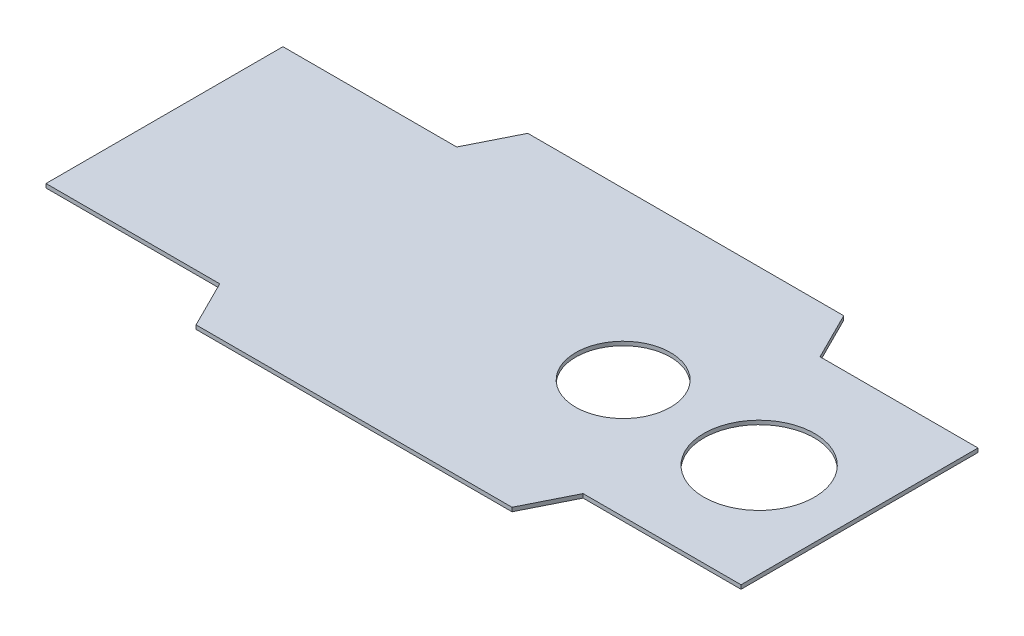
from build123d import *

# Parameters (mm, degrees)
BOSS_EXTRUDE1_DEPTH = 1.5875
SKETCH7_R           = 38.1
SKETCH7_R_2         = 44.45
CUT_EXTRUDE1_DEPTH  = 20.32


with BuildPart() as part:
    # Sketch3 → Boss-Extrude1 (new, symmetric)
    with BuildSketch(Plane(origin=(0, 0, 0), x_dir=(1, 0, 0), z_dir=(0, 1, 0))):
        Polygon((-279.4, 95.25), (-139.7, 95.25), (-120.65, 133.35), (133.35, 133.35), (152.4, 95.25), (279.4, 95.25), (279.4, -95.25), (152.4, -95.25), (133.35, -133.35), (-120.65, -133.35), (-139.7, -95.25), (-279.4, -95.25), align=None)
    extrude(amount=BOSS_EXTRUDE1_DEPTH, both=True)

    # Sketch7 → Cut-Extrude1 (cut)
    with BuildSketch(Plane(origin=(0, 1.5875, 0), x_dir=(1, 0, 0), z_dir=(0, 1, 0))):
        with Locations((89.349601684, 0)):
            Circle(SKETCH7_R)
        with Locations((203.500706879, -4.78485358)):
            Circle(SKETCH7_R_2)
    extrude(amount=-CUT_EXTRUDE1_DEPTH, mode=Mode.SUBTRACT)


solid = part.part
